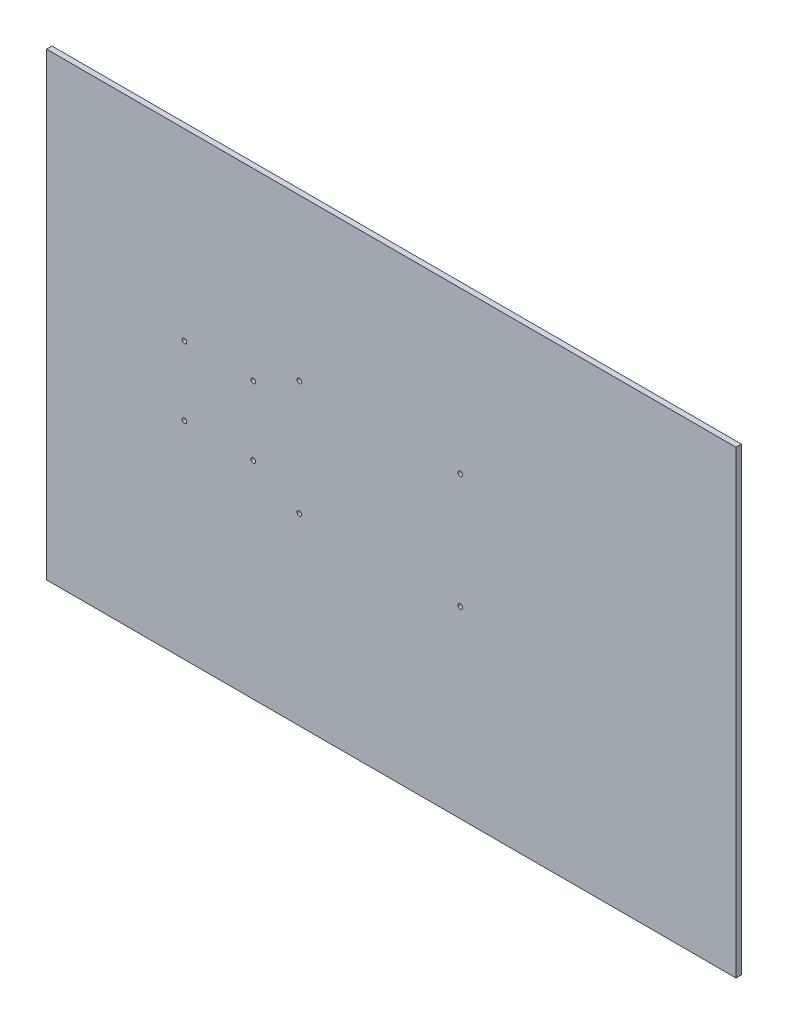
from build123d import *

# Parameters (mm, degrees)
SKETCH2_W           = 762
SKETCH2_H           = 508
SKETCH2_R           = 2.555
BOSS_EXTRUDE1_DEPTH = 6


with BuildPart() as part:
    # Sketch2 → Boss-Extrude1 (new body)
    with BuildSketch(Plane.XY):
        Rectangle(SKETCH2_W, SKETCH2_H)
        with Locations((-228.6, 50.8)):
            Circle(SKETCH2_R, mode=Mode.SUBTRACT)
        with Locations((-228.6, -25.4)):
            Circle(SKETCH2_R, mode=Mode.SUBTRACT)
        with Locations((-152.4, 50.8)):
            Circle(SKETCH2_R, mode=Mode.SUBTRACT)
        with Locations((-152.4, -25.4)):
            Circle(SKETCH2_R, mode=Mode.SUBTRACT)
        with Locations((-101.6, 76.2)):
            Circle(SKETCH2_R, mode=Mode.SUBTRACT)
        with Locations((-101.6, -50.8)):
            Circle(SKETCH2_R, mode=Mode.SUBTRACT)
        with Locations((76.2, 76.2)):
            Circle(SKETCH2_R, mode=Mode.SUBTRACT)
        with Locations((76.2, -50.8)):
            Circle(SKETCH2_R, mode=Mode.SUBTRACT)
    extrude(amount=BOSS_EXTRUDE1_DEPTH)


solid = part.part
